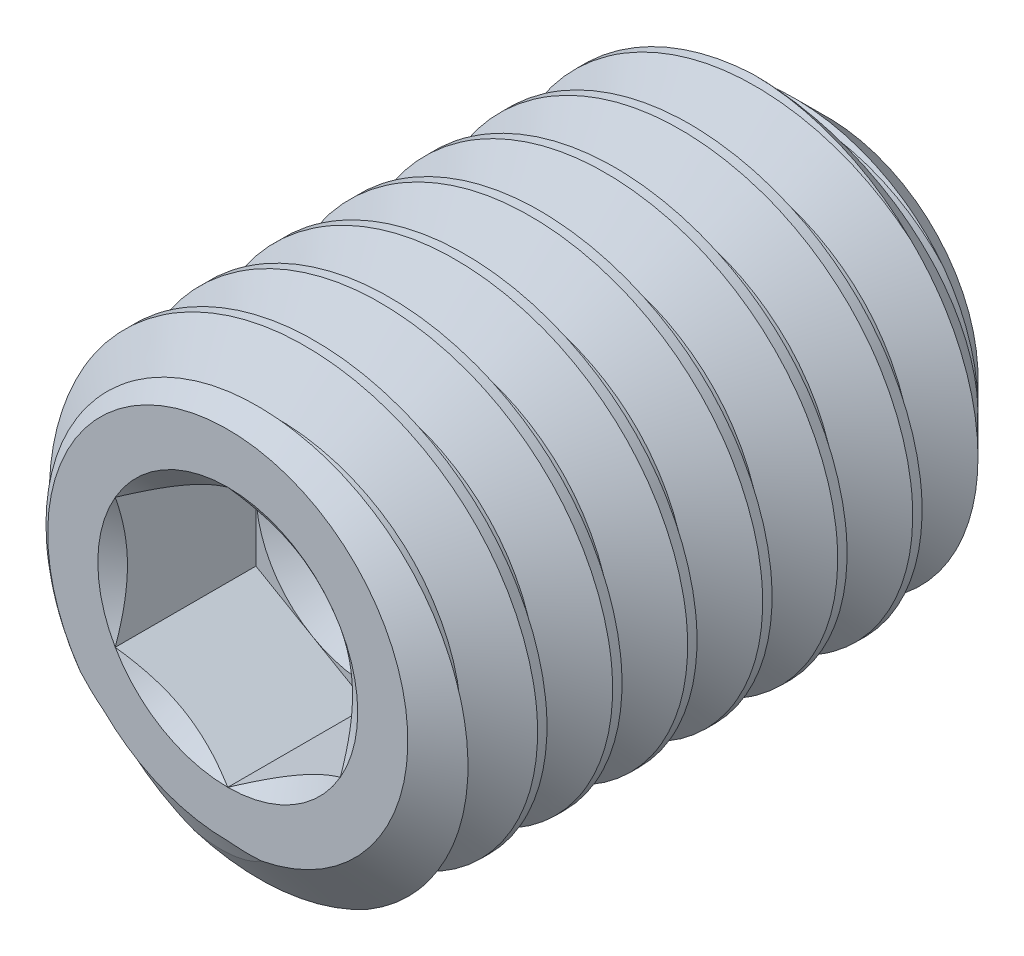
from build123d import *

# Parameters (mm, degrees)
CUT_SWEEP2_PITCH    = 0.5
CUT_EXTRUDE10_DEPTH = 0.9375


with BuildPart() as part:
    # Sketch22 → Revolve1 (revolve)
    with BuildSketch(Plane(origin=(0, 0, 0), x_dir=(0, 0, -1), z_dir=(1, 0, 0)), mode=Mode.PRIVATE) as revolve1_sk:
        Polygon((-2, 0), (-2, 1.2), (-1.789937739, 1.5), (1.5, 1.5), (2, 1), (2, 0), align=None)
    revolve(revolve1_sk.sketch.rotate(Axis((0, 0, -2), (0, 0, 1)), 90), axis=Axis((0, 0, -2), (0, 0, 1)))

    # Cut-Sweep2: the profile of Sketch28 profile screwed along a right-hand helix of 9 turns, 6 arcs to a turn; built about Z, then put on its axis
    cut_sweep2_z = Axis((0, 0, 0), (0, 0, 1))
    cut_sweep2_corners = [(1.5003, 0, 0.000173205), (1.5003, 0, -0.437673205), (1.175240474, 0, -0.25), (1.175240474, 0, -0.1875)]
    with BuildLine(mode=Mode.PRIVATE) as cut_sweep2_profile:
        Line(cut_sweep2_corners[0], cut_sweep2_corners[1])
        Line(cut_sweep2_corners[1], cut_sweep2_corners[2])
        Line(cut_sweep2_corners[2], cut_sweep2_corners[3])
        Line(cut_sweep2_corners[3], cut_sweep2_corners[0])
    cut_sweep2_cap = Face(cut_sweep2_profile.wire())
    cut_sweep2_turn_angles = [0, 30, 60, 90, 120, 150, 180, 210, 240, 270, 300, 330, 360]
    cut_sweep2_turn_weights = [1, 0.8660254037844387, 1, 0.8660254037844387, 1, 0.8660254037844387, 1, 0.8660254037844387, 1, 0.8660254037844387, 1, 0.8660254037844387, 1]
    cut_sweep2_turn_rails = [Edge.make_bspline([Vector(p[0], p[1], 0).rotate(cut_sweep2_z, cut_sweep2_turn_angles[k]) / cut_sweep2_turn_weights[k] + Vector(0, 0, p[2] + CUT_SWEEP2_PITCH * cut_sweep2_turn_angles[k] / 360) for k in range(13)], [0, 0, 0, 1, 1, 2, 2, 3, 3, 4, 4, 5, 5, 6, 6, 6], 2, cut_sweep2_turn_weights) for p in cut_sweep2_corners]
    cut_sweep2_turn_sides = [Face.make_surface_from_curves(cut_sweep2_turn_rails[p[0]], cut_sweep2_turn_rails[p[1]]) for p in [(0, 1), (1, 2), (2, 3), (3, 0)]]
    cut_sweep2 = Plane(origin=(0, 0, -2), x_dir=(0, 1, 0), z_dir=(0, 0, 1)) * Solid(Shell([*[p.moved(Location((0, 0, CUT_SWEEP2_PITCH * i))) for i in range(9) for p in cut_sweep2_turn_sides], cut_sweep2_cap, cut_sweep2_cap.rotate(cut_sweep2_z, 3240).moved(Location((0, 0, CUT_SWEEP2_PITCH * 3240 / 360)))]))
    add(cut_sweep2, mode=Mode.SUBTRACT)

    # Sketch23 → Cut-Extrude10 (cut)
    with BuildSketch(Plane.XY.offset(2)):
        Polygon((0, 0.866025404), (-0.75, 0.433012702), (-0.75, -0.433012702), (0, -0.866025404), (0.75, -0.433012702), (0.75, 0.433012702), align=None)
    extrude(amount=-CUT_EXTRUDE10_DEPTH, mode=Mode.SUBTRACT)

    # Cut-Extrude11 cone 1 section (through the dimple's axis) → Cut-Extrude11 (revolve, cut)
    with BuildSketch(Plane(origin=(0, 0, 2), x_dir=(0, -1, 0), z_dir=(1, 0, 0))):
        Polygon((0, 0), (0.866025404, 0), (0, 0.606397516), align=None)
    revolve(axis=Axis((0, 0, 2), (0, 0, -1)), mode=Mode.SUBTRACT)

    # Cut-Extrude12 cone 1 section (through the dimple's axis) → Cut-Extrude12 (revolve, cut)
    with BuildSketch(Plane(origin=(0, 0, 1.0625), x_dir=(0, -1, 0), z_dir=(1, 0, 0))):
        Polygon((0, 0), (0.75, 0), (0, 0.433012702), align=None)
    revolve(axis=Axis((0, 0, 1.0625), (0, 0, -1)), mode=Mode.SUBTRACT)


solid = part.part
